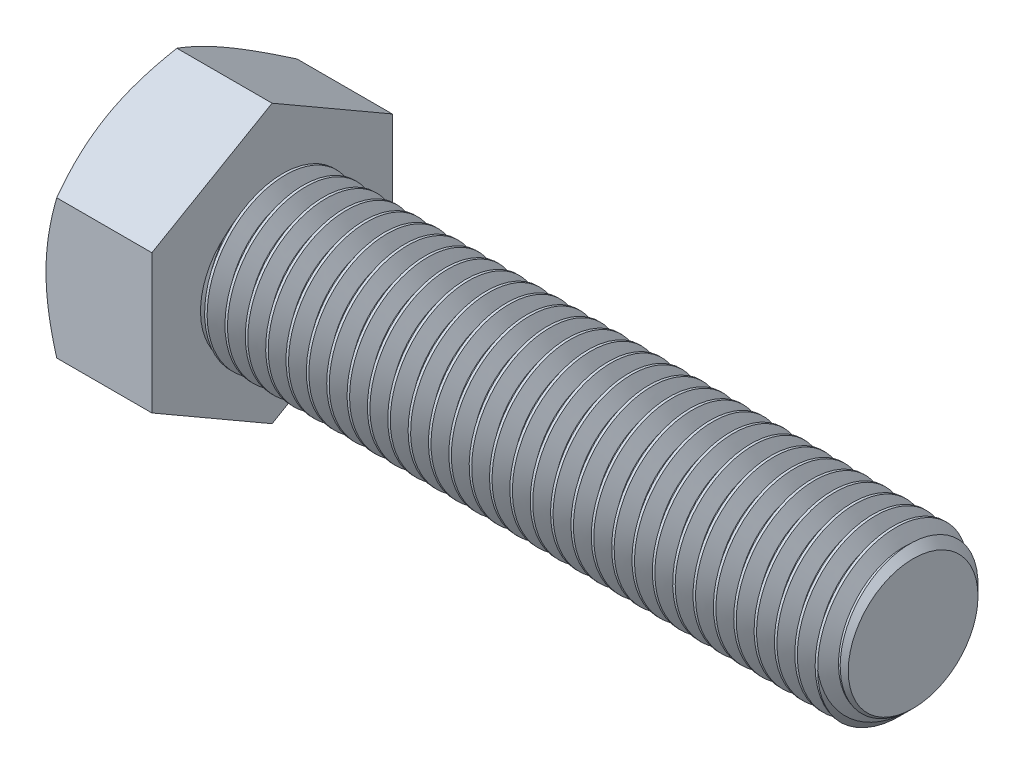
from build123d import *

# Parameters (mm, degrees)
SKETCH5_R           = 11.1125
BOSS_EXTRUDE3_DEPTH = 88.9
CHAMFER1_SIZE       = 2.116666667
CUT_SWEEP1_PITCH    = 2.822222222
BOSS_EXTRUDE4_DEPTH = 14.684375
SKETCH8_OUTSIDE_W   = 431.396
SKETCH8_OUTSIDE_H   = 436.552
SKETCH8_OUTSIDE_R   = 16.66875
CUT_EXTRUDE3_DEPTH  = 107.667862861
CUT_EXTRUDE3_DRAFT  = -60
CUT_EXTRUDE4_DEPTH  = 0.254
CIRPATTERN1_COUNT   = 6


with BuildPart() as part:
    # Sketch5 → Boss-Extrude3 (new body)
    with BuildSketch(Plane(origin=(51.7921875, 0, 0), x_dir=(0, 0, -1), z_dir=(1, 0, 0))):
        Circle(SKETCH5_R)
    extrude(amount=-BOSS_EXTRUDE3_DEPTH)

    # Chamfer1
    chamfer1_edges = [part.edges().sort_by_distance(p)[0] for p in [
        (51.7921875, 0, 11.1125),
    ]]
    chamfer(chamfer1_edges, length=CHAMFER1_SIZE)

    # Cut-Sweep1: arcs per turn and ends read off the stored shape
    # Cut-Sweep1: the profile of Sketch10 profile screwed along a right-hand helix through 32.5 turns, 10 arcs to a turn; built about Z, then put on its axis
    cut_sweep1_z = Axis((0, 0, 0), (0, 0, 1))
    cut_sweep1_corners = [(11.1128, 0, 0.000173205), (9.279412895, 0, -1.058333333), (9.279412895, 0, -1.411111111), (11.1128, 0, -2.46961765)]
    with BuildLine(mode=Mode.PRIVATE) as cut_sweep1_profile:
        Line(cut_sweep1_corners[0], cut_sweep1_corners[1])
        Line(cut_sweep1_corners[1], cut_sweep1_corners[2])
        Line(cut_sweep1_corners[2], cut_sweep1_corners[3])
        Line(cut_sweep1_corners[3], cut_sweep1_corners[0])
    cut_sweep1_cap = Face(cut_sweep1_profile.wire())
    cut_sweep1_turn_angles = [0, 18, 36, 54, 72, 90, 108, 126, 144, 162, 180, 198, 216, 234, 252, 270, 288, 306, 324, 342, 360]
    cut_sweep1_turn_weights = [1, 0.9510565162951535, 1, 0.9510565162951535, 1, 0.9510565162951535, 1, 0.9510565162951535, 1, 0.9510565162951535, 1, 0.9510565162951535, 1, 0.9510565162951535, 1, 0.9510565162951535, 1, 0.9510565162951535, 1, 0.9510565162951535, 1]
    cut_sweep1_turn_rails = [Edge.make_bspline([Vector(p[0], p[1], 0).rotate(cut_sweep1_z, cut_sweep1_turn_angles[k]) / cut_sweep1_turn_weights[k] + Vector(0, 0, p[2] + CUT_SWEEP1_PITCH * cut_sweep1_turn_angles[k] / 360) for k in range(21)], [0, 0, 0, 1, 1, 2, 2, 3, 3, 4, 4, 5, 5, 6, 6, 7, 7, 8, 8, 9, 9, 10, 10, 10], 2, cut_sweep1_turn_weights) for p in cut_sweep1_corners]
    cut_sweep1_turn_sides = [Face.make_surface_from_curves(cut_sweep1_turn_rails[p[0]], cut_sweep1_turn_rails[p[1]]) for p in [(0, 1), (1, 2), (2, 3), (3, 0)]]
    cut_sweep1_last_angles = [11520, 11538, 11556, 11574, 11592, 11610, 11628, 11646, 11664, 11682, 11700]
    cut_sweep1_last_weights = [1, 0.9510565162951535, 1, 0.9510565162951535, 1, 0.9510565162951535, 1, 0.9510565162951535, 1, 0.9510565162952174, 1]
    cut_sweep1_last_rails = [Edge.make_bspline([Vector(p[0], p[1], 0).rotate(cut_sweep1_z, cut_sweep1_last_angles[k]) / cut_sweep1_last_weights[k] + Vector(0, 0, p[2] + CUT_SWEEP1_PITCH * cut_sweep1_last_angles[k] / 360) for k in range(11)], [0, 0, 0, 1, 1, 2, 2, 3, 3, 4, 4, 5, 5, 5], 2, cut_sweep1_last_weights) for p in cut_sweep1_corners]
    cut_sweep1_last_sides = [Face.make_surface_from_curves(cut_sweep1_last_rails[p[0]], cut_sweep1_last_rails[p[1]]) for p in [(0, 1), (1, 2), (2, 3), (3, 0)]]
    cut_sweep1 = Plane(origin=(51.7921875, 0, 0), x_dir=(0, 1, 0), z_dir=(-1, 0, 0)) * Solid(Shell([*[p.moved(Location((0, 0, CUT_SWEEP1_PITCH * i))) for i in range(32) for p in cut_sweep1_turn_sides], *cut_sweep1_last_sides, cut_sweep1_cap, cut_sweep1_cap.rotate(cut_sweep1_z, 11700).moved(Location((0, 0, CUT_SWEEP1_PITCH * 11700 / 360)))]))
    add(cut_sweep1, mode=Mode.SUBTRACT)

    # Sketch6 → Boss-Extrude4 (add)
    with BuildSketch(Plane.ZY.offset(37.1078125)):
        Polygon((16.66875, 9.6237073), (0, 19.247414599), (-16.66875, 9.6237073), (-16.66875, -9.6237073), (0, -19.247414599), (16.66875, -9.6237073), align=None)
    extrude(amount=BOSS_EXTRUDE4_DEPTH)


with BuildPart() as cut_extrude3_tool:
    # Sketch8 outside → Cut-Extrude3 (with draft: the straight prism first)
    with BuildSketch(Plane.ZY.offset(51.7921875)):
        Rectangle(SKETCH8_OUTSIDE_W, SKETCH8_OUTSIDE_H)
        Circle(SKETCH8_OUTSIDE_R, mode=Mode.SUBTRACT)
    extrude(amount=-CUT_EXTRUDE3_DEPTH)
    # Cut-Extrude3: the draft: its side faces are tilted about the plane it starts from
    cut_extrude3_sides = [cut_extrude3_tool.faces().sort_by_distance(p)[0] for p in [
        (2.041743931, -218.276, 0),
        (2.041743931, 0, 215.698),
        (2.041743931, 218.276, 0),
        (2.041743931, 0, -215.698),
        (2.041743931, 0, -16.66875),
    ]]
    draft(cut_extrude3_sides, Plane.ZY.offset(51.7921875), CUT_EXTRUDE3_DRAFT)


with BuildPart() as part_1:
    add(part.part)

    # Cut-Extrude3: cut by cut_extrude3_tool
    add(cut_extrude3_tool.part, mode=Mode.SUBTRACT)

    # Sketch12 → Cut-Extrude4 (cut)
    with BuildSketch(Plane.ZY.offset(51.7921875)):
        with BuildLine():
            Line((0.5000625, 12.8349375), (0.5000625, 7.1675625))
            ThreePointArc((0.5000625, 7.1675625), (0, 6.6675), (-0.5000625, 7.1675625))
            Line((-0.5000625, 7.1675625), (-0.5000625, 12.8349375))
            ThreePointArc((-0.5000625, 12.8349375), (0, 13.335), (0.5000625, 12.8349375))
        make_face()
    cut_extrude4 = extrude(amount=-CUT_EXTRUDE4_DEPTH, mode=Mode.SUBTRACT)

    # CirPattern1: Cut-Extrude4 ×6 about axis
    cirpattern1_axis = Axis((0, 0, 0), (1, 0, 0))
    for i in range(1, CIRPATTERN1_COUNT):
        add(cut_extrude4.rotate(cirpattern1_axis, i * 360 / CIRPATTERN1_COUNT), mode=Mode.SUBTRACT)


solid = part_1.part
